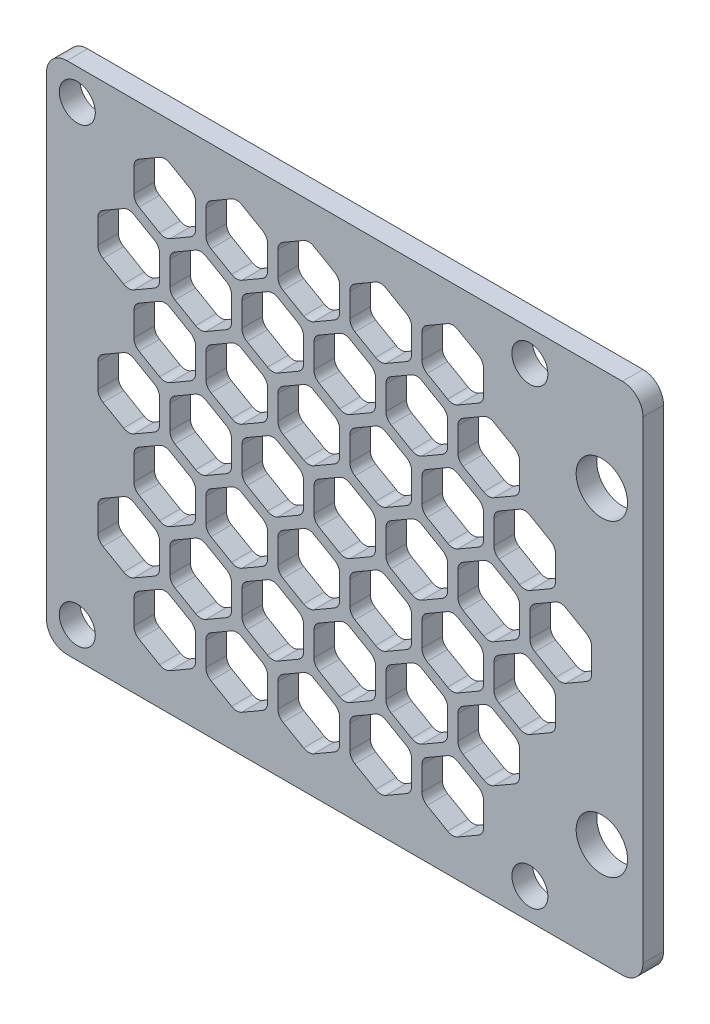
from build123d import *

# Parameters (mm, degrees)
ESQUISSE1_W                     = 58
ESQUISSE1_H                     = 50
ESQUISSE1_R                     = 1.75
BOSS_EXTRU_1_DEPTH              = 2
ESQUISSE2_R                     = 2.5
ENL_V_MAT_EXTRU_1_DEPTH         = 77.602872009
CONG_1_R                        = 2
ENL_V_MAT_EXTRU_2_DEPTH         = 77.602872009
ENL_V_MAT_EXTRU_2_DEPTH_BACK    = 77.602872009
R_P_TITION_DANS_UNE_ZONE1_DEPTH = 2


# Read off the part's stored shape, not the designer's step: Répétition dans une zone1
with BuildPart() as part:
    # Esquisse1 → Boss.-Extru.1 (new body)
    with BuildSketch(Plane.XY):
        with Locations((29, 25)):
            Rectangle(ESQUISSE1_W, ESQUISSE1_H)
        with Locations((3, 3)):
            Circle(ESQUISSE1_R, mode=Mode.SUBTRACT)
        with Locations(Location((47, 3, 0), (0, 0, 180))):
            Circle(ESQUISSE1_R, mode=Mode.SUBTRACT)
        with Locations((47, 47)):
            Circle(ESQUISSE1_R, mode=Mode.SUBTRACT)
        with Locations(Location((3, 47, 0), (0, 0, 180))):
            Circle(ESQUISSE1_R, mode=Mode.SUBTRACT)
    extrude(amount=BOSS_EXTRU_1_DEPTH)

    # Esquisse2 → Enlèv. mat.-Extru.1 (cut, through all)
    with BuildSketch(Plane.XY.offset(2)):
        with Locations((54, 10)):
            Circle(ESQUISSE2_R)
        with Locations(Location((54, 40, 0), (0, 0, 180))):
            Circle(ESQUISSE2_R)
    extrude(amount=-ENL_V_MAT_EXTRU_1_DEPTH, mode=Mode.SUBTRACT)

    # Congé1
    cong_1_edges = [part.edges().sort_by_distance(p)[0] for p in [
        (0, 50, 1),
        (58, 50, 1),
        (58, 0, 1),
        (0, 0, 1),
    ]]
    fillet(cong_1_edges, radius=CONG_1_R)

    # Esquisse3 → Enlèv. mat.-Extru.2 (cut, two sides: drawn at the far end of the back side and taken through both)
    with BuildSketch(Plane.XY.offset(2).offset(-ENL_V_MAT_EXTRU_2_DEPTH_BACK)):
        with BuildLine():
            Line((32, 23.845299462), (32, 26.154700538))
            ThreePointArc((32, 26.154700538), (31.866025404, 26.654700538), (31.5, 27.020725942))
            Line((31.5, 27.020725942), (29.5, 28.175426481))
            ThreePointArc((29.5, 28.175426481), (29, 28.309401077), (28.5, 28.175426481))
            Line((28.5, 28.175426481), (26.5, 27.020725942))
            ThreePointArc((26.5, 27.020725942), (26.133974596, 26.654700538), (26, 26.154700538))
            Line((26, 26.154700538), (26, 23.845299462))
            ThreePointArc((26, 23.845299462), (26.133974596, 23.345299462), (26.5, 22.979274058))
            Line((26.5, 22.979274058), (28.5, 21.824573519))
            ThreePointArc((28.5, 21.824573519), (29, 21.690598923), (29.5, 21.824573519))
            Line((29.5, 21.824573519), (31.5, 22.979274058))
            ThreePointArc((31.5, 22.979274058), (31.866025404, 23.345299462), (32, 23.845299462))
        make_face()
    extrude(amount=ENL_V_MAT_EXTRU_2_DEPTH + ENL_V_MAT_EXTRU_2_DEPTH_BACK, mode=Mode.SUBTRACT)

    # Répétition dans une zone1 outline → Répétition dans une zone1 (cut)
    with BuildSketch(Plane.XY):
        with BuildLine():
            ThreePointArc((5, 35.969655115), (5.133974596, 35.469655115), (5.5, 35.103629711))
            Line((5.5, 35.103629711), (7.5, 33.948929172))
            ThreePointArc((7.5, 33.948929172), (8, 33.814954576), (8.5, 33.948929172))
            Line((8.5, 33.948929172), (10.5, 35.103629711))
            ThreePointArc((10.5, 35.103629711), (10.866025404, 35.469655115), (11, 35.969655115))
            Line((11, 35.969655115), (11, 38.279056191))
            ThreePointArc((11, 38.279056191), (10.866025404, 38.779056191), (10.5, 39.145081595))
            Line((10.5, 39.145081595), (8.5, 40.299782134))
            ThreePointArc((8.5, 40.299782134), (8, 40.43375673), (7.5, 40.299782134))
            Line((7.5, 40.299782134), (5.5, 39.145081595))
            ThreePointArc((5.5, 39.145081595), (5.133974596, 38.779056191), (5, 38.279056191))
            Line((5, 38.279056191), (5, 35.969655115))
        make_face()
        with BuildLine():
            ThreePointArc((15.5, 29.907477288), (15.633974596, 29.407477288), (16, 29.041451884))
            Line((16, 29.041451884), (18, 27.886751346))
            ThreePointArc((18, 27.886751346), (18.5, 27.75277675), (19, 27.886751346))
            Line((19, 27.886751346), (21, 29.041451884))
            ThreePointArc((21, 29.041451884), (21.366025404, 29.407477288), (21.5, 29.907477288))
            Line((21.5, 29.907477288), (21.5, 32.216878365))
            ThreePointArc((21.5, 32.216878365), (21.366025404, 32.716878365), (21, 33.082903769))
            Line((21, 33.082903769), (19, 34.237604307))
            ThreePointArc((19, 34.237604307), (18.5, 34.371578903), (18, 34.237604307))
            Line((18, 34.237604307), (16, 33.082903769))
            ThreePointArc((16, 33.082903769), (15.633974596, 32.716878365), (15.5, 32.216878365))
            Line((15.5, 32.216878365), (15.5, 29.907477288))
        make_face()
        with BuildLine():
            ThreePointArc((36.5, 17.783121635), (36.633974596, 17.283121635), (37, 16.917096231))
            Line((37, 16.917096231), (39, 15.762395693))
            ThreePointArc((39, 15.762395693), (39.5, 15.628421097), (40, 15.762395693))
            Line((40, 15.762395693), (42, 16.917096231))
            ThreePointArc((42, 16.917096231), (42.366025404, 17.283121635), (42.5, 17.783121635))
            Line((42.5, 17.783121635), (42.5, 20.092522712))
            ThreePointArc((42.5, 20.092522712), (42.366025404, 20.592522712), (42, 20.958548116))
            Line((42, 20.958548116), (40, 22.113248654))
            ThreePointArc((40, 22.113248654), (39.5, 22.24722325), (39, 22.113248654))
            Line((39, 22.113248654), (37, 20.958548116))
            ThreePointArc((37, 20.958548116), (36.633974596, 20.592522712), (36.5, 20.092522712))
            Line((36.5, 20.092522712), (36.5, 17.783121635))
        make_face()
        with BuildLine():
            ThreePointArc((26.5, 39.145081595), (26.133974596, 38.779056191), (26, 38.279056191))
            Line((26, 38.279056191), (26, 35.969655115))
            ThreePointArc((26, 35.969655115), (26.133974596, 35.469655115), (26.5, 35.103629711))
            Line((26.5, 35.103629711), (28.5, 33.948929172))
            ThreePointArc((28.5, 33.948929172), (29, 33.814954576), (29.5, 33.948929172))
            Line((29.5, 33.948929172), (31.5, 35.103629711))
            ThreePointArc((31.5, 35.103629711), (31.866025404, 35.469655115), (32, 35.969655115))
            Line((32, 35.969655115), (32, 38.279056191))
            ThreePointArc((32, 38.279056191), (31.866025404, 38.779056191), (31.5, 39.145081595))
            Line((31.5, 39.145081595), (29.5, 40.299782134))
            ThreePointArc((29.5, 40.299782134), (29, 40.43375673), (28.5, 40.299782134))
            Line((28.5, 40.299782134), (26.5, 39.145081595))
        make_face()
        with BuildLine():
            ThreePointArc((26.5, 14.896370289), (26.133974596, 14.530344885), (26, 14.030344885))
            Line((26, 14.030344885), (26, 11.720943809))
            ThreePointArc((26, 11.720943809), (26.133974596, 11.220943809), (26.5, 10.854918405))
            Line((26.5, 10.854918405), (28.5, 9.700217866))
            ThreePointArc((28.5, 9.700217866), (29, 9.56624327), (29.5, 9.700217866))
            Line((29.5, 9.700217866), (31.5, 10.854918405))
            ThreePointArc((31.5, 10.854918405), (31.866025404, 11.220943809), (32, 11.720943809))
            Line((32, 11.720943809), (32, 14.030344885))
            ThreePointArc((32, 14.030344885), (31.866025404, 14.530344885), (31.5, 14.896370289))
            Line((31.5, 14.896370289), (29.5, 16.051070828))
            ThreePointArc((29.5, 16.051070828), (29, 16.185045424), (28.5, 16.051070828))
            Line((28.5, 16.051070828), (26.5, 14.896370289))
        make_face()
        with BuildLine():
            ThreePointArc((19, 22.113248654), (18.5, 22.24722325), (18, 22.113248654))
            Line((18, 22.113248654), (16, 20.958548116))
            ThreePointArc((16, 20.958548116), (15.633974596, 20.592522712), (15.5, 20.092522712))
            Line((15.5, 20.092522712), (15.5, 17.783121635))
            ThreePointArc((15.5, 17.783121635), (15.633974596, 17.283121635), (16, 16.917096231))
            Line((16, 16.917096231), (18, 15.762395693))
            ThreePointArc((18, 15.762395693), (18.5, 15.628421097), (19, 15.762395693))
            Line((19, 15.762395693), (21, 16.917096231))
            ThreePointArc((21, 16.917096231), (21.366025404, 17.283121635), (21.5, 17.783121635))
            Line((21.5, 17.783121635), (21.5, 20.092522712))
            ThreePointArc((21.5, 20.092522712), (21.366025404, 20.592522712), (21, 20.958548116))
            Line((21, 20.958548116), (19, 22.113248654))
        make_face()
        with BuildLine():
            ThreePointArc((8.5, 16.051070828), (8, 16.185045424), (7.5, 16.051070828))
            Line((7.5, 16.051070828), (5.5, 14.896370289))
            ThreePointArc((5.5, 14.896370289), (5.133974596, 14.530344885), (5, 14.030344885))
            Line((5, 14.030344885), (5, 11.720943809))
            ThreePointArc((5, 11.720943809), (5.133974596, 11.220943809), (5.5, 10.854918405))
            Line((5.5, 10.854918405), (7.5, 9.700217866))
            ThreePointArc((7.5, 9.700217866), (8, 9.56624327), (8.5, 9.700217866))
            Line((8.5, 9.700217866), (10.5, 10.854918405))
            ThreePointArc((10.5, 10.854918405), (10.866025404, 11.220943809), (11, 11.720943809))
            Line((11, 11.720943809), (11, 14.030344885))
            ThreePointArc((11, 14.030344885), (10.866025404, 14.530344885), (10.5, 14.896370289))
            Line((10.5, 14.896370289), (8.5, 16.051070828))
        make_face()
        with BuildLine():
            ThreePointArc((40, 34.237604307), (39.5, 34.371578903), (39, 34.237604307))
            Line((39, 34.237604307), (37, 33.082903769))
            ThreePointArc((37, 33.082903769), (36.633974596, 32.716878365), (36.5, 32.216878365))
            Line((36.5, 32.216878365), (36.5, 29.907477288))
            ThreePointArc((36.5, 29.907477288), (36.633974596, 29.407477288), (37, 29.041451884))
            Line((37, 29.041451884), (39, 27.886751346))
            ThreePointArc((39, 27.886751346), (39.5, 27.75277675), (40, 27.886751346))
            Line((40, 27.886751346), (42, 29.041451884))
            ThreePointArc((42, 29.041451884), (42.366025404, 29.407477288), (42.5, 29.907477288))
            Line((42.5, 29.907477288), (42.5, 32.216878365))
            ThreePointArc((42.5, 32.216878365), (42.366025404, 32.716878365), (42, 33.082903769))
            Line((42, 33.082903769), (40, 34.237604307))
        make_face()
        with BuildLine():
            ThreePointArc((5.5, 27.020725942), (5.133974596, 26.654700538), (5, 26.154700538))
            Line((5, 26.154700538), (5, 23.845299462))
            ThreePointArc((5, 23.845299462), (5.133974596, 23.345299462), (5.5, 22.979274058))
            Line((5.5, 22.979274058), (7.5, 21.824573519))
            ThreePointArc((7.5, 21.824573519), (8, 21.690598923), (8.5, 21.824573519))
            Line((8.5, 21.824573519), (10.5, 22.979274058))
            ThreePointArc((10.5, 22.979274058), (10.866025404, 23.345299462), (11, 23.845299462))
            Line((11, 23.845299462), (11, 26.154700538))
            ThreePointArc((11, 26.154700538), (10.866025404, 26.654700538), (10.5, 27.020725942))
            Line((10.5, 27.020725942), (8.5, 28.175426481))
            ThreePointArc((8.5, 28.175426481), (8, 28.309401077), (7.5, 28.175426481))
            Line((7.5, 28.175426481), (5.5, 27.020725942))
        make_face()
        with BuildLine():
            ThreePointArc((19, 46.36195996), (18.5, 46.495934556), (18, 46.36195996))
            Line((18, 46.36195996), (16, 45.207259422))
            ThreePointArc((16, 45.207259422), (15.633974596, 44.841234018), (15.5, 44.341234018))
            Line((15.5, 44.341234018), (15.5, 42.031832941))
            ThreePointArc((15.5, 42.031832941), (15.633974596, 41.531832941), (16, 41.165807537))
            Line((16, 41.165807537), (18, 40.011106999))
            ThreePointArc((18, 40.011106999), (18.5, 39.877132403), (19, 40.011106999))
            Line((19, 40.011106999), (21, 41.165807537))
            ThreePointArc((21, 41.165807537), (21.366025404, 41.531832941), (21.5, 42.031832941))
            Line((21.5, 42.031832941), (21.5, 44.341234018))
            ThreePointArc((21.5, 44.341234018), (21.366025404, 44.841234018), (21, 45.207259422))
            Line((21, 45.207259422), (19, 46.36195996))
        make_face()
        with BuildLine():
            Line((23, 41.165807537), (25, 40.011106999))
            ThreePointArc((25, 40.011106999), (25.5, 39.877132403), (26, 40.011106999))
            Line((26, 40.011106999), (28, 41.165807537))
            ThreePointArc((28, 41.165807537), (28.366025404, 41.531832941), (28.5, 42.031832941))
            Line((28.5, 42.031832941), (28.5, 44.341234018))
            ThreePointArc((28.5, 44.341234018), (28.366025404, 44.841234018), (28, 45.207259422))
            Line((28, 45.207259422), (26, 46.36195996))
            ThreePointArc((26, 46.36195996), (25.5, 46.495934556), (25, 46.36195996))
            Line((25, 46.36195996), (23, 45.207259422))
            ThreePointArc((23, 45.207259422), (22.633974596, 44.841234018), (22.5, 44.341234018))
            Line((22.5, 44.341234018), (22.5, 42.031832941))
            ThreePointArc((22.5, 42.031832941), (22.633974596, 41.531832941), (23, 41.165807537))
        make_face()
        with BuildLine():
            ThreePointArc((43.5, 29.907477288), (43.633974596, 29.407477288), (44, 29.041451884))
            Line((44, 29.041451884), (46, 27.886751346))
            ThreePointArc((46, 27.886751346), (46.5, 27.75277675), (47, 27.886751346))
            Line((47, 27.886751346), (49, 29.041451884))
            ThreePointArc((49, 29.041451884), (49.366025404, 29.407477288), (49.5, 29.907477288))
            Line((49.5, 29.907477288), (49.5, 32.216878365))
            ThreePointArc((49.5, 32.216878365), (49.366025404, 32.716878365), (49, 33.082903769))
            Line((49, 33.082903769), (47, 34.237604307))
            ThreePointArc((47, 34.237604307), (46.5, 34.371578903), (46, 34.237604307))
            Line((46, 34.237604307), (44, 33.082903769))
            ThreePointArc((44, 33.082903769), (43.633974596, 32.716878365), (43.5, 32.216878365))
            Line((43.5, 32.216878365), (43.5, 29.907477288))
        make_face()
        with BuildLine():
            ThreePointArc((33, 35.969655115), (33.133974596, 35.469655115), (33.5, 35.103629711))
            Line((33.5, 35.103629711), (35.5, 33.948929172))
            ThreePointArc((35.5, 33.948929172), (36, 33.814954576), (36.5, 33.948929172))
            Line((36.5, 33.948929172), (38.5, 35.103629711))
            ThreePointArc((38.5, 35.103629711), (38.866025404, 35.469655115), (39, 35.969655115))
            Line((39, 35.969655115), (39, 38.279056191))
            ThreePointArc((39, 38.279056191), (38.866025404, 38.779056191), (38.5, 39.145081595))
            Line((38.5, 39.145081595), (36.5, 40.299782134))
            ThreePointArc((36.5, 40.299782134), (36, 40.43375673), (35.5, 40.299782134))
            Line((35.5, 40.299782134), (33.5, 39.145081595))
            ThreePointArc((33.5, 39.145081595), (33.133974596, 38.779056191), (33, 38.279056191))
            Line((33, 38.279056191), (33, 35.969655115))
        make_face()
        with BuildLine():
            ThreePointArc((23, 33.082903769), (22.633974596, 32.716878365), (22.5, 32.216878365))
            Line((22.5, 32.216878365), (22.5, 29.907477288))
            ThreePointArc((22.5, 29.907477288), (22.633974596, 29.407477288), (23, 29.041451884))
            Line((23, 29.041451884), (25, 27.886751346))
            ThreePointArc((25, 27.886751346), (25.5, 27.75277675), (26, 27.886751346))
            Line((26, 27.886751346), (28, 29.041451884))
            ThreePointArc((28, 29.041451884), (28.366025404, 29.407477288), (28.5, 29.907477288))
            Line((28.5, 29.907477288), (28.5, 32.216878365))
            ThreePointArc((28.5, 32.216878365), (28.366025404, 32.716878365), (28, 33.082903769))
            Line((28, 33.082903769), (26, 34.237604307))
            ThreePointArc((26, 34.237604307), (25.5, 34.371578903), (25, 34.237604307))
            Line((25, 34.237604307), (23, 33.082903769))
        make_face()
        with BuildLine():
            ThreePointArc((23, 20.958548116), (22.633974596, 20.592522712), (22.5, 20.092522712))
            Line((22.5, 20.092522712), (22.5, 17.783121635))
            ThreePointArc((22.5, 17.783121635), (22.633974596, 17.283121635), (23, 16.917096231))
            Line((23, 16.917096231), (25, 15.762395693))
            ThreePointArc((25, 15.762395693), (25.5, 15.628421097), (26, 15.762395693))
            Line((26, 15.762395693), (28, 16.917096231))
            ThreePointArc((28, 16.917096231), (28.366025404, 17.283121635), (28.5, 17.783121635))
            Line((28.5, 17.783121635), (28.5, 20.092522712))
            ThreePointArc((28.5, 20.092522712), (28.366025404, 20.592522712), (28, 20.958548116))
            Line((28, 20.958548116), (26, 22.113248654))
            ThreePointArc((26, 22.113248654), (25.5, 22.24722325), (25, 22.113248654))
            Line((25, 22.113248654), (23, 20.958548116))
        make_face()
        with BuildLine():
            ThreePointArc((23, 8.834192463), (22.633974596, 8.468167059), (22.5, 7.968167059))
            Line((22.5, 7.968167059), (22.5, 5.658765982))
            ThreePointArc((22.5, 5.658765982), (22.633974596, 5.158765982), (23, 4.792740578))
            Line((23, 4.792740578), (25, 3.63804004))
            ThreePointArc((25, 3.63804004), (25.5, 3.504065444), (26, 3.63804004))
            Line((26, 3.63804004), (28, 4.792740578))
            ThreePointArc((28, 4.792740578), (28.366025404, 5.158765982), (28.5, 5.658765982))
            Line((28.5, 5.658765982), (28.5, 7.968167059))
            ThreePointArc((28.5, 7.968167059), (28.366025404, 8.468167059), (28, 8.834192463))
            Line((28, 8.834192463), (26, 9.988893001))
            ThreePointArc((26, 9.988893001), (25.5, 10.122867597), (25, 9.988893001))
            Line((25, 9.988893001), (23, 8.834192463))
        make_face()
        with BuildLine():
            ThreePointArc((15.5, 40.299782134), (15, 40.43375673), (14.5, 40.299782134))
            Line((14.5, 40.299782134), (12.5, 39.145081595))
            ThreePointArc((12.5, 39.145081595), (12.133974596, 38.779056191), (12, 38.279056191))
            Line((12, 38.279056191), (12, 35.969655115))
            ThreePointArc((12, 35.969655115), (12.133974596, 35.469655115), (12.5, 35.103629711))
            Line((12.5, 35.103629711), (14.5, 33.948929172))
            ThreePointArc((14.5, 33.948929172), (15, 33.814954576), (15.5, 33.948929172))
            Line((15.5, 33.948929172), (17.5, 35.103629711))
            ThreePointArc((17.5, 35.103629711), (17.866025404, 35.469655115), (18, 35.969655115))
            Line((18, 35.969655115), (18, 38.279056191))
            ThreePointArc((18, 38.279056191), (17.866025404, 38.779056191), (17.5, 39.145081595))
            Line((17.5, 39.145081595), (15.5, 40.299782134))
        make_face()
        with BuildLine():
            Line((19.5, 35.103629711), (21.5, 33.948929172))
            ThreePointArc((21.5, 33.948929172), (22, 33.814954576), (22.5, 33.948929172))
            Line((22.5, 33.948929172), (24.5, 35.103629711))
            ThreePointArc((24.5, 35.103629711), (24.866025404, 35.469655115), (25, 35.969655115))
            Line((25, 35.969655115), (25, 38.279056191))
            ThreePointArc((25, 38.279056191), (24.866025404, 38.779056191), (24.5, 39.145081595))
            Line((24.5, 39.145081595), (22.5, 40.299782134))
            ThreePointArc((22.5, 40.299782134), (22, 40.43375673), (21.5, 40.299782134))
            Line((21.5, 40.299782134), (19.5, 39.145081595))
            ThreePointArc((19.5, 39.145081595), (19.133974596, 38.779056191), (19, 38.279056191))
            Line((19, 38.279056191), (19, 35.969655115))
            ThreePointArc((19, 35.969655115), (19.133974596, 35.469655115), (19.5, 35.103629711))
        make_face()
        with BuildLine():
            ThreePointArc((8.5, 42.031832941), (8.633974596, 41.531832941), (9, 41.165807537))
            Line((9, 41.165807537), (11, 40.011106999))
            ThreePointArc((11, 40.011106999), (11.5, 39.877132403), (12, 40.011106999))
            Line((12, 40.011106999), (14, 41.165807537))
            ThreePointArc((14, 41.165807537), (14.366025404, 41.531832941), (14.5, 42.031832941))
            Line((14.5, 42.031832941), (14.5, 44.341234018))
            ThreePointArc((14.5, 44.341234018), (14.366025404, 44.841234018), (14, 45.207259422))
            Line((14, 45.207259422), (12, 46.36195996))
            ThreePointArc((12, 46.36195996), (11.5, 46.495934556), (11, 46.36195996))
            Line((11, 46.36195996), (9, 45.207259422))
            ThreePointArc((9, 45.207259422), (8.633974596, 44.841234018), (8.5, 44.341234018))
            Line((8.5, 44.341234018), (8.5, 42.031832941))
        make_face()
        with BuildLine():
            ThreePointArc((40, 23.845299462), (40.133974596, 23.345299462), (40.5, 22.979274058))
            Line((40.5, 22.979274058), (42.5, 21.824573519))
            ThreePointArc((42.5, 21.824573519), (43, 21.690598923), (43.5, 21.824573519))
            Line((43.5, 21.824573519), (45.5, 22.979274058))
            ThreePointArc((45.5, 22.979274058), (45.866025404, 23.345299462), (46, 23.845299462))
            Line((46, 23.845299462), (46, 26.154700538))
            ThreePointArc((46, 26.154700538), (45.866025404, 26.654700538), (45.5, 27.020725942))
            Line((45.5, 27.020725942), (43.5, 28.175426481))
            ThreePointArc((43.5, 28.175426481), (43, 28.309401077), (42.5, 28.175426481))
            Line((42.5, 28.175426481), (40.5, 27.020725942))
            ThreePointArc((40.5, 27.020725942), (40.133974596, 26.654700538), (40, 26.154700538))
            Line((40, 26.154700538), (40, 23.845299462))
        make_face()
        with BuildLine():
            ThreePointArc((29.5, 29.907477288), (29.633974596, 29.407477288), (30, 29.041451884))
            Line((30, 29.041451884), (32, 27.886751346))
            ThreePointArc((32, 27.886751346), (32.5, 27.75277675), (33, 27.886751346))
            Line((33, 27.886751346), (35, 29.041451884))
            ThreePointArc((35, 29.041451884), (35.366025404, 29.407477288), (35.5, 29.907477288))
            Line((35.5, 29.907477288), (35.5, 32.216878365))
            ThreePointArc((35.5, 32.216878365), (35.366025404, 32.716878365), (35, 33.082903769))
            Line((35, 33.082903769), (33, 34.237604307))
            ThreePointArc((33, 34.237604307), (32.5, 34.371578903), (32, 34.237604307))
            Line((32, 34.237604307), (30, 33.082903769))
            ThreePointArc((30, 33.082903769), (29.633974596, 32.716878365), (29.5, 32.216878365))
            Line((29.5, 32.216878365), (29.5, 29.907477288))
        make_face()
        with BuildLine():
            ThreePointArc((19.5, 27.020725942), (19.133974596, 26.654700538), (19, 26.154700538))
            Line((19, 26.154700538), (19, 23.845299462))
            ThreePointArc((19, 23.845299462), (19.133974596, 23.345299462), (19.5, 22.979274058))
            Line((19.5, 22.979274058), (21.5, 21.824573519))
            ThreePointArc((21.5, 21.824573519), (22, 21.690598923), (22.5, 21.824573519))
            Line((22.5, 21.824573519), (24.5, 22.979274058))
            ThreePointArc((24.5, 22.979274058), (24.866025404, 23.345299462), (25, 23.845299462))
            Line((25, 23.845299462), (25, 26.154700538))
            ThreePointArc((25, 26.154700538), (24.866025404, 26.654700538), (24.5, 27.020725942))
            Line((24.5, 27.020725942), (22.5, 28.175426481))
            ThreePointArc((22.5, 28.175426481), (22, 28.309401077), (21.5, 28.175426481))
            Line((21.5, 28.175426481), (19.5, 27.020725942))
        make_face()
        with BuildLine():
            ThreePointArc((19.5, 14.896370289), (19.133974596, 14.530344885), (19, 14.030344885))
            Line((19, 14.030344885), (19, 11.720943809))
            ThreePointArc((19, 11.720943809), (19.133974596, 11.220943809), (19.5, 10.854918405))
            Line((19.5, 10.854918405), (21.5, 9.700217866))
            ThreePointArc((21.5, 9.700217866), (22, 9.56624327), (22.5, 9.700217866))
            Line((22.5, 9.700217866), (24.5, 10.854918405))
            ThreePointArc((24.5, 10.854918405), (24.866025404, 11.220943809), (25, 11.720943809))
            Line((25, 11.720943809), (25, 14.030344885))
            ThreePointArc((25, 14.030344885), (24.866025404, 14.530344885), (24.5, 14.896370289))
            Line((24.5, 14.896370289), (22.5, 16.051070828))
            ThreePointArc((22.5, 16.051070828), (22, 16.185045424), (21.5, 16.051070828))
            Line((21.5, 16.051070828), (19.5, 14.896370289))
        make_face()
        with BuildLine():
            ThreePointArc((33, 46.36195996), (32.5, 46.495934556), (32, 46.36195996))
            Line((32, 46.36195996), (30, 45.207259422))
            ThreePointArc((30, 45.207259422), (29.633974596, 44.841234018), (29.5, 44.341234018))
            Line((29.5, 44.341234018), (29.5, 42.031832941))
            ThreePointArc((29.5, 42.031832941), (29.633974596, 41.531832941), (30, 41.165807537))
            Line((30, 41.165807537), (32, 40.011106999))
            ThreePointArc((32, 40.011106999), (32.5, 39.877132403), (33, 40.011106999))
            Line((33, 40.011106999), (35, 41.165807537))
            ThreePointArc((35, 41.165807537), (35.366025404, 41.531832941), (35.5, 42.031832941))
            Line((35.5, 42.031832941), (35.5, 44.341234018))
            ThreePointArc((35.5, 44.341234018), (35.366025404, 44.841234018), (35, 45.207259422))
            Line((35, 45.207259422), (33, 46.36195996))
        make_face()
        with BuildLine():
            ThreePointArc((12, 34.237604307), (11.5, 34.371578903), (11, 34.237604307))
            Line((11, 34.237604307), (9, 33.082903769))
            ThreePointArc((9, 33.082903769), (8.633974596, 32.716878365), (8.5, 32.216878365))
            Line((8.5, 32.216878365), (8.5, 29.907477288))
            ThreePointArc((8.5, 29.907477288), (8.633974596, 29.407477288), (9, 29.041451884))
            Line((9, 29.041451884), (11, 27.886751346))
            ThreePointArc((11, 27.886751346), (11.5, 27.75277675), (12, 27.886751346))
            Line((12, 27.886751346), (14, 29.041451884))
            ThreePointArc((14, 29.041451884), (14.366025404, 29.407477288), (14.5, 29.907477288))
            Line((14.5, 29.907477288), (14.5, 32.216878365))
            ThreePointArc((14.5, 32.216878365), (14.366025404, 32.716878365), (14, 33.082903769))
            Line((14, 33.082903769), (12, 34.237604307))
        make_face()
        with BuildLine():
            Line((12.5, 10.854918405), (14.5, 9.700217866))
            ThreePointArc((14.5, 9.700217866), (15, 9.56624327), (15.5, 9.700217866))
            Line((15.5, 9.700217866), (17.5, 10.854918405))
            ThreePointArc((17.5, 10.854918405), (17.866025404, 11.220943809), (18, 11.720943809))
            Line((18, 11.720943809), (18, 14.030344885))
            ThreePointArc((18, 14.030344885), (17.866025404, 14.530344885), (17.5, 14.896370289))
            Line((17.5, 14.896370289), (15.5, 16.051070828))
            ThreePointArc((15.5, 16.051070828), (15, 16.185045424), (14.5, 16.051070828))
            Line((14.5, 16.051070828), (12.5, 14.896370289))
            ThreePointArc((12.5, 14.896370289), (12.133974596, 14.530344885), (12, 14.030344885))
            Line((12, 14.030344885), (12, 11.720943809))
            ThreePointArc((12, 11.720943809), (12.133974596, 11.220943809), (12.5, 10.854918405))
        make_face()
        with BuildLine():
            ThreePointArc((12.5, 27.020725942), (12.133974596, 26.654700538), (12, 26.154700538))
            Line((12, 26.154700538), (12, 23.845299462))
            ThreePointArc((12, 23.845299462), (12.133974596, 23.345299462), (12.5, 22.979274058))
            Line((12.5, 22.979274058), (14.5, 21.824573519))
            ThreePointArc((14.5, 21.824573519), (15, 21.690598923), (15.5, 21.824573519))
            Line((15.5, 21.824573519), (17.5, 22.979274058))
            ThreePointArc((17.5, 22.979274058), (17.866025404, 23.345299462), (18, 23.845299462))
            Line((18, 23.845299462), (18, 26.154700538))
            ThreePointArc((18, 26.154700538), (17.866025404, 26.654700538), (17.5, 27.020725942))
            Line((17.5, 27.020725942), (15.5, 28.175426481))
            ThreePointArc((15.5, 28.175426481), (15, 28.309401077), (14.5, 28.175426481))
            Line((14.5, 28.175426481), (12.5, 27.020725942))
        make_face()
        with BuildLine():
            ThreePointArc((36.5, 28.175426481), (36, 28.309401077), (35.5, 28.175426481))
            Line((35.5, 28.175426481), (33.5, 27.020725942))
            ThreePointArc((33.5, 27.020725942), (33.133974596, 26.654700538), (33, 26.154700538))
            Line((33, 26.154700538), (33, 23.845299462))
            ThreePointArc((33, 23.845299462), (33.133974596, 23.345299462), (33.5, 22.979274058))
            Line((33.5, 22.979274058), (35.5, 21.824573519))
            ThreePointArc((35.5, 21.824573519), (36, 21.690598923), (36.5, 21.824573519))
            Line((36.5, 21.824573519), (38.5, 22.979274058))
            ThreePointArc((38.5, 22.979274058), (38.866025404, 23.345299462), (39, 23.845299462))
            Line((39, 23.845299462), (39, 26.154700538))
            ThreePointArc((39, 26.154700538), (38.866025404, 26.654700538), (38.5, 27.020725942))
            Line((38.5, 27.020725942), (36.5, 28.175426481))
        make_face()
        with BuildLine():
            ThreePointArc((36.5, 5.658765982), (36.633974596, 5.158765982), (37, 4.792740578))
            Line((37, 4.792740578), (39, 3.63804004))
            ThreePointArc((39, 3.63804004), (39.5, 3.504065444), (40, 3.63804004))
            Line((40, 3.63804004), (42, 4.792740578))
            ThreePointArc((42, 4.792740578), (42.366025404, 5.158765982), (42.5, 5.658765982))
            Line((42.5, 5.658765982), (42.5, 7.968167059))
            ThreePointArc((42.5, 7.968167059), (42.366025404, 8.468167059), (42, 8.834192463))
            Line((42, 8.834192463), (40, 9.988893001))
            ThreePointArc((40, 9.988893001), (39.5, 10.122867597), (39, 9.988893001))
            Line((39, 9.988893001), (37, 8.834192463))
            ThreePointArc((37, 8.834192463), (36.633974596, 8.468167059), (36.5, 7.968167059))
            Line((36.5, 7.968167059), (36.5, 5.658765982))
        make_face()
        with BuildLine():
            ThreePointArc((16, 8.834192463), (15.633974596, 8.468167059), (15.5, 7.968167059))
            Line((15.5, 7.968167059), (15.5, 5.658765982))
            ThreePointArc((15.5, 5.658765982), (15.633974596, 5.158765982), (16, 4.792740578))
            Line((16, 4.792740578), (18, 3.63804004))
            ThreePointArc((18, 3.63804004), (18.5, 3.504065444), (19, 3.63804004))
            Line((19, 3.63804004), (21, 4.792740578))
            ThreePointArc((21, 4.792740578), (21.366025404, 5.158765982), (21.5, 5.658765982))
            Line((21.5, 5.658765982), (21.5, 7.968167059))
            ThreePointArc((21.5, 7.968167059), (21.366025404, 8.468167059), (21, 8.834192463))
            Line((21, 8.834192463), (19, 9.988893001))
            ThreePointArc((19, 9.988893001), (18.5, 10.122867597), (18, 9.988893001))
            Line((18, 9.988893001), (16, 8.834192463))
        make_face()
        with BuildLine():
            Line((9, 4.792740578), (11, 3.63804004))
            ThreePointArc((11, 3.63804004), (11.5, 3.504065444), (12, 3.63804004))
            Line((12, 3.63804004), (14, 4.792740578))
            ThreePointArc((14, 4.792740578), (14.366025404, 5.158765982), (14.5, 5.658765982))
            Line((14.5, 5.658765982), (14.5, 7.968167059))
            ThreePointArc((14.5, 7.968167059), (14.366025404, 8.468167059), (14, 8.834192463))
            Line((14, 8.834192463), (12, 9.988893001))
            ThreePointArc((12, 9.988893001), (11.5, 10.122867597), (11, 9.988893001))
            Line((11, 9.988893001), (9, 8.834192463))
            ThreePointArc((9, 8.834192463), (8.633974596, 8.468167059), (8.5, 7.968167059))
            Line((8.5, 7.968167059), (8.5, 5.658765982))
            ThreePointArc((8.5, 5.658765982), (8.633974596, 5.158765982), (9, 4.792740578))
        make_face()
        with BuildLine():
            ThreePointArc((9, 20.958548116), (8.633974596, 20.592522712), (8.5, 20.092522712))
            Line((8.5, 20.092522712), (8.5, 17.783121635))
            ThreePointArc((8.5, 17.783121635), (8.633974596, 17.283121635), (9, 16.917096231))
            Line((9, 16.917096231), (11, 15.762395693))
            ThreePointArc((11, 15.762395693), (11.5, 15.628421097), (12, 15.762395693))
            Line((12, 15.762395693), (14, 16.917096231))
            ThreePointArc((14, 16.917096231), (14.366025404, 17.283121635), (14.5, 17.783121635))
            Line((14.5, 17.783121635), (14.5, 20.092522712))
            ThreePointArc((14.5, 20.092522712), (14.366025404, 20.592522712), (14, 20.958548116))
            Line((14, 20.958548116), (12, 22.113248654))
            ThreePointArc((12, 22.113248654), (11.5, 22.24722325), (11, 22.113248654))
            Line((11, 22.113248654), (9, 20.958548116))
        make_face()
        with BuildLine():
            ThreePointArc((33, 22.113248654), (32.5, 22.24722325), (32, 22.113248654))
            Line((32, 22.113248654), (30, 20.958548116))
            ThreePointArc((30, 20.958548116), (29.633974596, 20.592522712), (29.5, 20.092522712))
            Line((29.5, 20.092522712), (29.5, 17.783121635))
            ThreePointArc((29.5, 17.783121635), (29.633974596, 17.283121635), (30, 16.917096231))
            Line((30, 16.917096231), (32, 15.762395693))
            ThreePointArc((32, 15.762395693), (32.5, 15.628421097), (33, 15.762395693))
            Line((33, 15.762395693), (35, 16.917096231))
            ThreePointArc((35, 16.917096231), (35.366025404, 17.283121635), (35.5, 17.783121635))
            Line((35.5, 17.783121635), (35.5, 20.092522712))
            ThreePointArc((35.5, 20.092522712), (35.366025404, 20.592522712), (35, 20.958548116))
            Line((35, 20.958548116), (33, 22.113248654))
        make_face()
        with BuildLine():
            ThreePointArc((47, 23.845299462), (47.133974596, 23.345299462), (47.5, 22.979274058))
            Line((47.5, 22.979274058), (49.5, 21.824573519))
            ThreePointArc((49.5, 21.824573519), (50, 21.690598923), (50.5, 21.824573519))
            Line((50.5, 21.824573519), (52.5, 22.979274058))
            ThreePointArc((52.5, 22.979274058), (52.866025404, 23.345299462), (53, 23.845299462))
            Line((53, 23.845299462), (53, 26.154700538))
            ThreePointArc((53, 26.154700538), (52.866025404, 26.654700538), (52.5, 27.020725942))
            Line((52.5, 27.020725942), (50.5, 28.175426481))
            ThreePointArc((50.5, 28.175426481), (50, 28.309401077), (49.5, 28.175426481))
            Line((49.5, 28.175426481), (47.5, 27.020725942))
            ThreePointArc((47.5, 27.020725942), (47.133974596, 26.654700538), (47, 26.154700538))
            Line((47, 26.154700538), (47, 23.845299462))
        make_face()
        with BuildLine():
            ThreePointArc((40, 46.36195996), (39.5, 46.495934556), (39, 46.36195996))
            Line((39, 46.36195996), (37, 45.207259422))
            ThreePointArc((37, 45.207259422), (36.633974596, 44.841234018), (36.5, 44.341234018))
            Line((36.5, 44.341234018), (36.5, 42.031832941))
            ThreePointArc((36.5, 42.031832941), (36.633974596, 41.531832941), (37, 41.165807537))
            Line((37, 41.165807537), (39, 40.011106999))
            ThreePointArc((39, 40.011106999), (39.5, 39.877132403), (40, 40.011106999))
            Line((40, 40.011106999), (42, 41.165807537))
            ThreePointArc((42, 41.165807537), (42.366025404, 41.531832941), (42.5, 42.031832941))
            Line((42.5, 42.031832941), (42.5, 44.341234018))
            ThreePointArc((42.5, 44.341234018), (42.366025404, 44.841234018), (42, 45.207259422))
            Line((42, 45.207259422), (40, 46.36195996))
        make_face()
        with BuildLine():
            ThreePointArc((40, 35.969655115), (40.133974596, 35.469655115), (40.5, 35.103629711))
            Line((40.5, 35.103629711), (42.5, 33.948929172))
            ThreePointArc((42.5, 33.948929172), (43, 33.814954576), (43.5, 33.948929172))
            Line((43.5, 33.948929172), (45.5, 35.103629711))
            ThreePointArc((45.5, 35.103629711), (45.866025404, 35.469655115), (46, 35.969655115))
            Line((46, 35.969655115), (46, 38.279056191))
            ThreePointArc((46, 38.279056191), (45.866025404, 38.779056191), (45.5, 39.145081595))
            Line((45.5, 39.145081595), (43.5, 40.299782134))
            ThreePointArc((43.5, 40.299782134), (43, 40.43375673), (42.5, 40.299782134))
            Line((42.5, 40.299782134), (40.5, 39.145081595))
            ThreePointArc((40.5, 39.145081595), (40.133974596, 38.779056191), (40, 38.279056191))
            Line((40, 38.279056191), (40, 35.969655115))
        make_face()
        with BuildLine():
            ThreePointArc((30, 8.834192463), (29.633974596, 8.468167059), (29.5, 7.968167059))
            Line((29.5, 7.968167059), (29.5, 5.658765982))
            ThreePointArc((29.5, 5.658765982), (29.633974596, 5.158765982), (30, 4.792740578))
            Line((30, 4.792740578), (32, 3.63804004))
            ThreePointArc((32, 3.63804004), (32.5, 3.504065444), (33, 3.63804004))
            Line((33, 3.63804004), (35, 4.792740578))
            ThreePointArc((35, 4.792740578), (35.366025404, 5.158765982), (35.5, 5.658765982))
            Line((35.5, 5.658765982), (35.5, 7.968167059))
            ThreePointArc((35.5, 7.968167059), (35.366025404, 8.468167059), (35, 8.834192463))
            Line((35, 8.834192463), (33, 9.988893001))
            ThreePointArc((33, 9.988893001), (32.5, 10.122867597), (32, 9.988893001))
            Line((32, 9.988893001), (30, 8.834192463))
        make_face()
        with BuildLine():
            ThreePointArc((40, 11.720943809), (40.133974596, 11.220943809), (40.5, 10.854918405))
            Line((40.5, 10.854918405), (42.5, 9.700217866))
            ThreePointArc((42.5, 9.700217866), (43, 9.56624327), (43.5, 9.700217866))
            Line((43.5, 9.700217866), (45.5, 10.854918405))
            ThreePointArc((45.5, 10.854918405), (45.866025404, 11.220943809), (46, 11.720943809))
            Line((46, 11.720943809), (46, 14.030344885))
            ThreePointArc((46, 14.030344885), (45.866025404, 14.530344885), (45.5, 14.896370289))
            Line((45.5, 14.896370289), (43.5, 16.051070828))
            ThreePointArc((43.5, 16.051070828), (43, 16.185045424), (42.5, 16.051070828))
            Line((42.5, 16.051070828), (40.5, 14.896370289))
            ThreePointArc((40.5, 14.896370289), (40.133974596, 14.530344885), (40, 14.030344885))
            Line((40, 14.030344885), (40, 11.720943809))
        make_face()
        with BuildLine():
            ThreePointArc((43.5, 17.783121635), (43.633974596, 17.283121635), (44, 16.917096231))
            Line((44, 16.917096231), (46, 15.762395693))
            ThreePointArc((46, 15.762395693), (46.5, 15.628421097), (47, 15.762395693))
            Line((47, 15.762395693), (49, 16.917096231))
            ThreePointArc((49, 16.917096231), (49.366025404, 17.283121635), (49.5, 17.783121635))
            Line((49.5, 17.783121635), (49.5, 20.092522712))
            ThreePointArc((49.5, 20.092522712), (49.366025404, 20.592522712), (49, 20.958548116))
            Line((49, 20.958548116), (47, 22.113248654))
            ThreePointArc((47, 22.113248654), (46.5, 22.24722325), (46, 22.113248654))
            Line((46, 22.113248654), (44, 20.958548116))
            ThreePointArc((44, 20.958548116), (43.633974596, 20.592522712), (43.5, 20.092522712))
            Line((43.5, 20.092522712), (43.5, 17.783121635))
        make_face()
        with BuildLine():
            ThreePointArc((33, 11.720943809), (33.133974596, 11.220943809), (33.5, 10.854918405))
            Line((33.5, 10.854918405), (35.5, 9.700217866))
            ThreePointArc((35.5, 9.700217866), (36, 9.56624327), (36.5, 9.700217866))
            Line((36.5, 9.700217866), (38.5, 10.854918405))
            ThreePointArc((38.5, 10.854918405), (38.866025404, 11.220943809), (39, 11.720943809))
            Line((39, 11.720943809), (39, 14.030344885))
            ThreePointArc((39, 14.030344885), (38.866025404, 14.530344885), (38.5, 14.896370289))
            Line((38.5, 14.896370289), (36.5, 16.051070828))
            ThreePointArc((36.5, 16.051070828), (36, 16.185045424), (35.5, 16.051070828))
            Line((35.5, 16.051070828), (33.5, 14.896370289))
            ThreePointArc((33.5, 14.896370289), (33.133974596, 14.530344885), (33, 14.030344885))
            Line((33, 14.030344885), (33, 11.720943809))
        make_face()
    extrude(amount=R_P_TITION_DANS_UNE_ZONE1_DEPTH, mode=Mode.SUBTRACT)


solid = part.part
